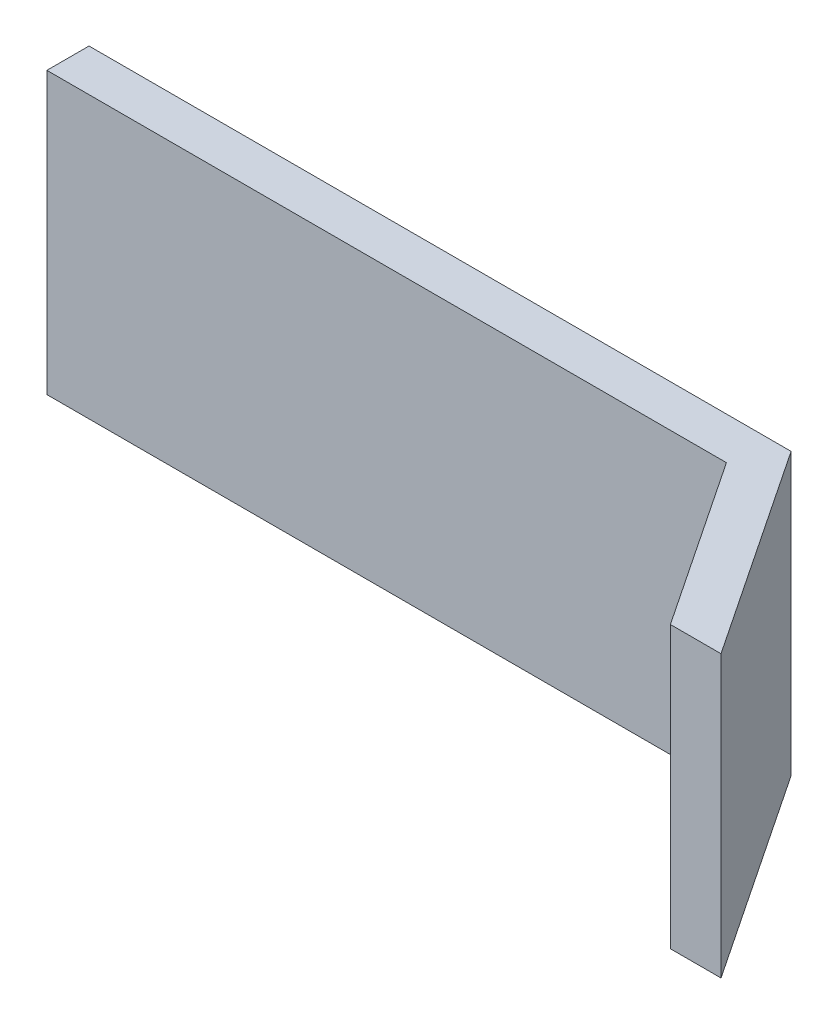
from build123d import *

# Parameters (mm, degrees)
BOSS_EXTRUDE1_DEPTH = 20


with BuildPart() as part:
    # Sketch1 → Boss-Extrude1 (new body)
    with BuildSketch(Plane(origin=(0, 0, 0), x_dir=(1, 0, 0), z_dir=(0, 1, 0))):
        Polygon((0, 0), (0, 3), (50, 3), (59.984585881, -11.976917065), (56.379037438, -11.976917065), (48.39444645, 0), align=None)
    extrude(amount=BOSS_EXTRUDE1_DEPTH)


solid = part.part
